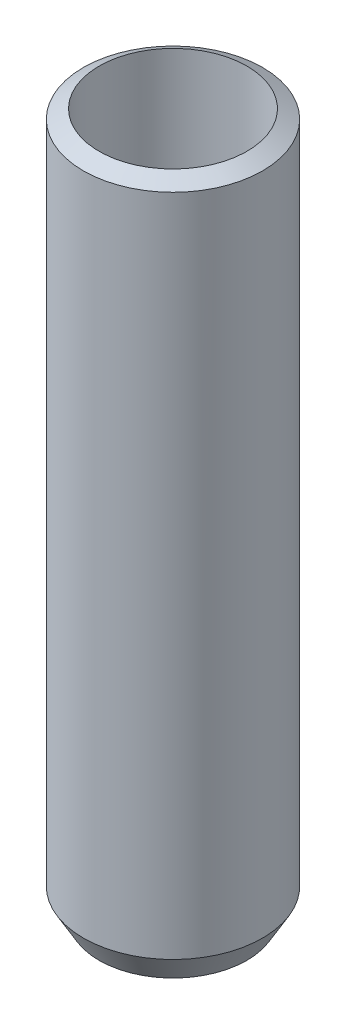
from build123d import *

# Parameters (mm, degrees)
SKETCH1_R           = 25
BOSS_EXTRUDE1_DEPTH = 198.941748
SKETCH2_R           = 20.620747434
CUT_EXTRUDE1_DEPTH  = 203.05894956


with BuildPart() as part:
    # Sketch1 → Boss-Extrude1 (new body)
    with BuildSketch(Plane(origin=(0, 0, 0), x_dir=(1, 0, 0), z_dir=(0, 1, 0))):
        with Locations(Location((0, 0, 0), (0, 0, 270))):
            Circle(SKETCH1_R)
    extrude(amount=BOSS_EXTRUDE1_DEPTH)

    # Sketch2 → Cut-Extrude1 (cut, through all)
    with BuildSketch(Plane(origin=(0, 0, 0), x_dir=(1, 0, 0), z_dir=(0, 1, 0))):
        with Locations(Location((0, 0, 0), (0, 0, 270))):
            Circle(SKETCH2_R)
    extrude(amount=CUT_EXTRUDE1_DEPTH, mode=Mode.SUBTRACT)

    # Chamfer1: read off the stored shape, not the designer's step
    # Chamfer1 outline → Chamfer1 (revolve, cut)
    with BuildSketch(Plane.XY):
        Polygon((25, 193.982213725), (25, 198.94174834), (20.620747434, 198.94174834), (20.620747434, 196.510576373), align=None)
        Polygon((25, 8.590165934), (20.620747434, 1.005077991), (20.620747434, 0), (25, 0), align=None)
    revolve(axis=Axis((0, 0, 0), (0, 1, 0)), mode=Mode.SUBTRACT)


solid = part.part
